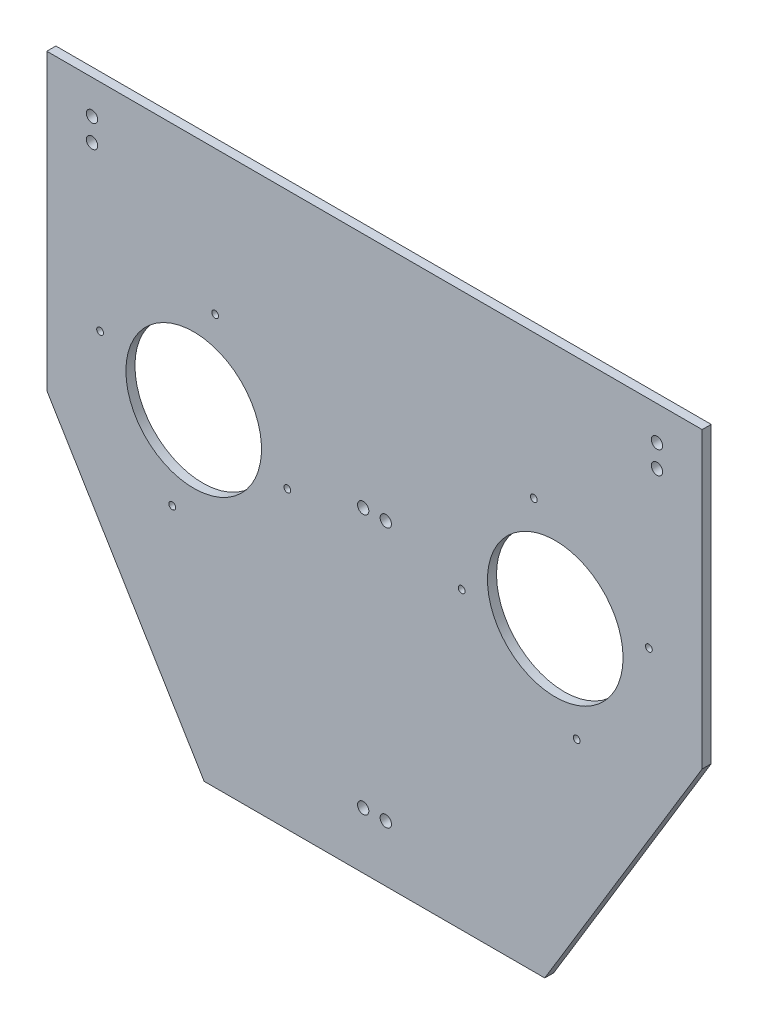
from build123d import *

# Parameters (mm, degrees)
SKETCH1_R           = 2.5
BOSS_EXTRUDE1_DEPTH = 4
SKETCH2_R           = 1.5
SKETCH2_R_2         = 30
SKETCH2_R_3         = 2.5
CUT_EXTRUDE1_DEPTH  = 10


with BuildPart() as part:
    # Sketch1 → Boss-Extrude1 (new body)
    with BuildSketch(Plane.XY):
        Polygon((-145, -10.079428341), (-75.355046254, -125), (75.355046254, -125), (145, -10.079428341), (145, 120), (-145, 120), align=None)
        with Locations((-125, 95)):
            Circle(SKETCH1_R, mode=Mode.SUBTRACT)
        with Locations((-125, 105)):
            Circle(SKETCH1_R, mode=Mode.SUBTRACT)
        with Locations((125, 95)):
            Circle(SKETCH1_R, mode=Mode.SUBTRACT)
        with Locations((125, 105)):
            Circle(SKETCH1_R, mode=Mode.SUBTRACT)
        with Locations((5, -100)):
            Circle(SKETCH1_R, mode=Mode.SUBTRACT)
        with Locations((-5, -100)):
            Circle(SKETCH1_R, mode=Mode.SUBTRACT)
    extrude(amount=BOSS_EXTRUDE1_DEPTH)

    # Sketch2 → Cut-Extrude1 (cut)
    with BuildSketch(Plane.XY.offset(4)):
        with Locations((38.573620895, 5.507628631)):
            Circle(SKETCH2_R)
        with Locations((70.507628631, 56.426379105)):
            Circle(SKETCH2_R)
        with Locations((121.426379105, 24.492371369)):
            Circle(SKETCH2_R)
        with Locations((89.492371369, -26.426379105)):
            Circle(SKETCH2_R)
        with Locations((80, 15)):
            Circle(SKETCH2_R_2)
        with Locations((-38.573620895, 5.507628631)):
            Circle(SKETCH2_R)
        with Locations((-70.507628631, 56.426379105)):
            Circle(SKETCH2_R)
        with Locations((-89.492371369, -26.426379105)):
            Circle(SKETCH2_R)
        with Locations((-121.426379105, 24.492371369)):
            Circle(SKETCH2_R)
        with Locations((-80, 15)):
            Circle(SKETCH2_R_2)
        with Locations((-5, 15)):
            Circle(SKETCH2_R_3)
        with Locations((5, 15)):
            Circle(SKETCH2_R_3)
    extrude(amount=-CUT_EXTRUDE1_DEPTH, mode=Mode.SUBTRACT)


solid = part.part
